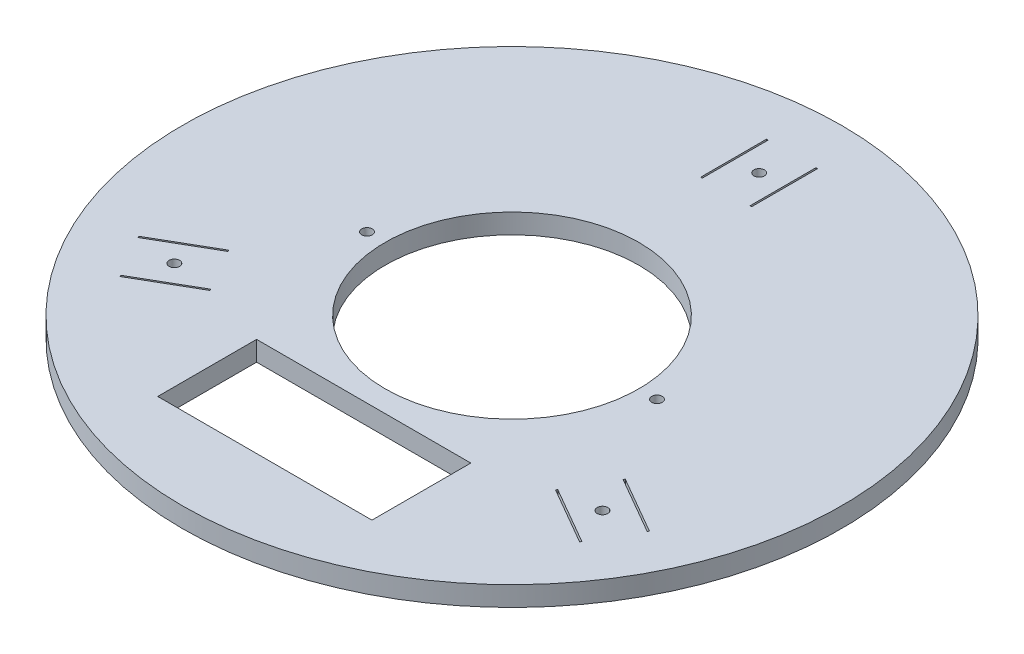
from build123d import *

# Parameters (mm, degrees)
SKETCH2_R           = 100
BOSS_EXTRUDE1_DEPTH = 6
SKETCH3_R           = 1.6
SKETCH3_W           = 0.5
SKETCH3_H           = 20
CUT_EXTRUDE1_DEPTH  = 142.548578234
SKETCH4_R           = 38.5
CUT_EXTRUDE2_DEPTH  = 142.548578234
SKETCH5_R           = 1.6
CUT_EXTRUDE3_DEPTH  = 142.548578234
SKETCH6_W           = 65
SKETCH6_H           = 30
CUT_EXTRUDE4_DEPTH  = 142.548578234


with BuildPart() as part:
    # Sketch2 → Boss-Extrude1 (new body)
    with BuildSketch(Plane(origin=(0, 0, 0), x_dir=(1, 0, 0), z_dir=(0, 1, 0))):
        Circle(SKETCH2_R)
    extrude(amount=BOSS_EXTRUDE1_DEPTH)

    # Sketch3 → Cut-Extrude1 (cut, through all)
    with BuildSketch(Plane(origin=(0, 6, 0), x_dir=(1, 0, 0), z_dir=(0, 1, 0))):
        with Locations((0, 75)):
            Circle(SKETCH3_R)
        with Locations((64.951905284, -37.5)):
            Circle(SKETCH3_R)
        with Locations((-64.951905284, -37.5)):
            Circle(SKETCH3_R)
        with Locations((-7.5, 75)):
            Rectangle(SKETCH3_W, SKETCH3_H)
        with Locations((7.5, 75)):
            Rectangle(SKETCH3_W, SKETCH3_H)
        Polygon((60.166651246, -25.788303121), (77.487159322, -35.788303121), (77.237159322, -36.221315823), (59.916651246, -26.221315823), align=None)
        Polygon((52.666651246, -38.778684177), (69.987159322, -48.778684177), (69.737159322, -49.211696879), (52.416651246, -39.211696879), align=None)
        Polygon((-52.416651246, -39.211696879), (-69.737159322, -49.211696879), (-69.987159322, -48.778684177), (-52.666651246, -38.778684177), align=None)
        Polygon((-59.916651246, -26.221315823), (-77.237159322, -36.221315823), (-77.487159322, -35.788303121), (-60.166651246, -25.788303121), align=None)
    extrude(amount=-CUT_EXTRUDE1_DEPTH, mode=Mode.SUBTRACT)

    # Sketch4 → Cut-Extrude2 (cut, through all)
    with BuildSketch(Plane(origin=(0, 6, 0), x_dir=(1, 0, 0), z_dir=(0, 1, 0))):
        Circle(SKETCH4_R)
    extrude(amount=-CUT_EXTRUDE2_DEPTH, mode=Mode.SUBTRACT)

    # Sketch5 → Cut-Extrude3 (cut, through all)
    with BuildSketch(Plane(origin=(0, 6, 0), x_dir=(1, 0, 0), z_dir=(0, 1, 0))):
        with Locations((-44, 0)):
            Circle(SKETCH5_R)
        with Locations((44, 0)):
            Circle(SKETCH5_R)
    extrude(amount=-CUT_EXTRUDE3_DEPTH, mode=Mode.SUBTRACT)

    # Sketch6 → Cut-Extrude4 (cut, through all)
    with BuildSketch(Plane(origin=(0, 6, 0), x_dir=(1, 0, 0), z_dir=(0, 1, 0))):
        with Locations((0, -60)):
            Rectangle(SKETCH6_W, SKETCH6_H)
    extrude(amount=-CUT_EXTRUDE4_DEPTH, mode=Mode.SUBTRACT)


solid = part.part
